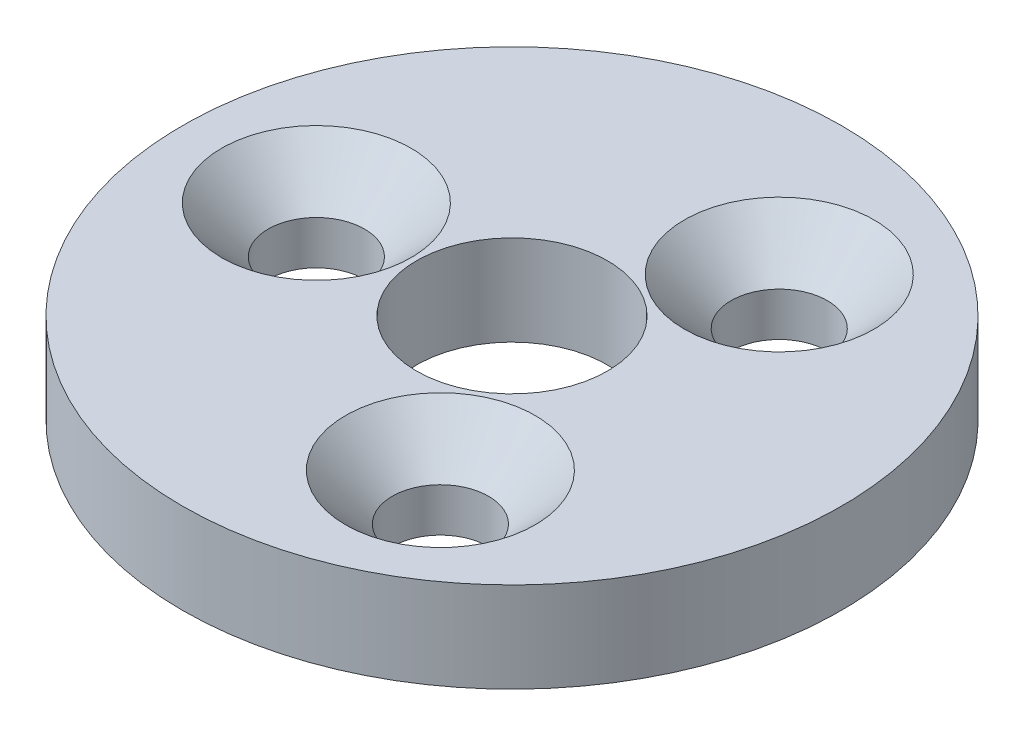
from build123d import *

# Parameters (mm, degrees)
SKETCH1_R                                    = 10.95
SKETCH1_R_2                                  = 3.175
BOSS_EXTRUDE1_DEPTH                          = 3
CSK_FOR_M3_COUNTERSUNK_RAISED_HEAD_S_2_COUNT = 2
CSK_FOR_M3_COUNTERSUNK_RAISED_HEAD_S_2_PITCH = 11.258330249
CSK_FOR_M3_COUNTERSUNK_RAISED_HEAD_S_3_COUNT = 2
CSK_FOR_M3_COUNTERSUNK_RAISED_HEAD_S_3_PITCH = 11.258330249


with BuildPart() as part:
    # Sketch1 → Boss-Extrude1 (new body)
    with BuildSketch(Plane(origin=(0, 0, 0), x_dir=(1, 0, 0), z_dir=(0, 1, 0))):
        Circle(SKETCH1_R)
        Circle(SKETCH1_R_2, mode=Mode.SUBTRACT)
    extrude(amount=BOSS_EXTRUDE1_DEPTH)

    # Sketch4 → CSK for M3 Countersunk Raised Head Screw1 (revolve, cut)
    with BuildSketch(Plane(origin=(-6.5, 3, 0), x_dir=(0, 0, 1), z_dir=(1, 0, 0))):
        Polygon((0, 0), (0, 3), (1.6, 3), (1.6, 1.55), (3.15, 0), align=None)
    csk_for_m3_countersunk_raised_head_screw = revolve(axis=Axis((-6.5, 9.35, 0), (0, -1, 0)), mode=Mode.SUBTRACT)

    # CSK for M3 Countersunk Raised Head S 2: CSK for M3 Countersunk Raised Head Screw1 ×2
    with Locations(*[Vector(0.8660254037844398, 0, -0.4999999999999981) * (i * CSK_FOR_M3_COUNTERSUNK_RAISED_HEAD_S_2_PITCH) for i in range(1, CSK_FOR_M3_COUNTERSUNK_RAISED_HEAD_S_2_COUNT)]):
        add(csk_for_m3_countersunk_raised_head_screw, mode=Mode.SUBTRACT)

    # CSK for M3 Countersunk Raised Head S 3: CSK for M3 Countersunk Raised Head Screw1 ×2
    with Locations(*[Vector(0.8660254037844365, 0, 0.5000000000000039) * (i * CSK_FOR_M3_COUNTERSUNK_RAISED_HEAD_S_3_PITCH) for i in range(1, CSK_FOR_M3_COUNTERSUNK_RAISED_HEAD_S_3_COUNT)]):
        add(csk_for_m3_countersunk_raised_head_screw, mode=Mode.SUBTRACT)


solid = part.part
